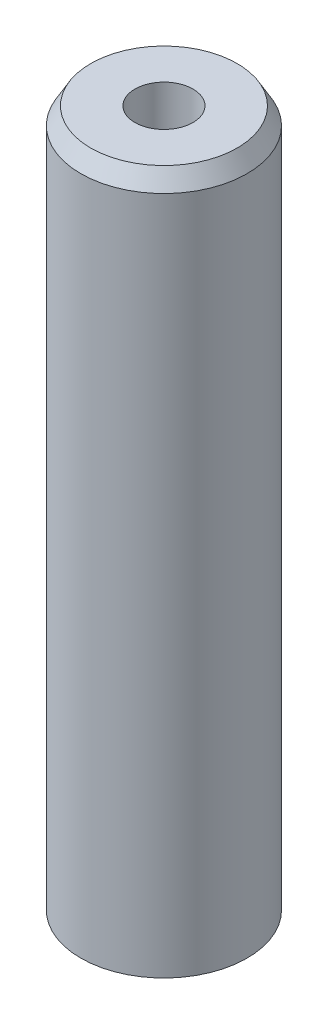
from build123d import *
from OCP.BRepFilletAPI import BRepFilletAPI_MakeChamfer

# Parameters (mm, degrees)
SKETCH1_R           = 25
BOSS_EXTRUDE1_DEPTH = 212.388772593
SKETCH2_R           = 8.729034927
CUT_EXTRUDE1_DEPTH  = 216.31138085
CHAMFER1_SIZE       = 5.175578628
CHAMFER1_SIZE2      = 2.988121714


with BuildPart() as part:
    # Sketch1 → Boss-Extrude1 (new body)
    with BuildSketch(Plane(origin=(0, 0, 0), x_dir=(1, 0, 0), z_dir=(0, 1, 0))):
        Circle(SKETCH1_R)
    extrude(amount=BOSS_EXTRUDE1_DEPTH)

    # Sketch2 → Cut-Extrude1 (cut, through all)
    with BuildSketch(Plane(origin=(0, 0, 0), x_dir=(1, 0, 0), z_dir=(0, 1, 0))):
        Circle(SKETCH2_R)
    extrude(amount=CUT_EXTRUDE1_DEPTH, mode=Mode.SUBTRACT)

    # Chamfer1: one chamfer whose edges measure the first distance from different faces: ONE call of the kernel's chamfer builder (chamfer() names one face for all edges)
    chamfer1_edges_1 = [part.edges().sort_by_distance(p)[0] for p in [
        (-25, 212.388772593, 0),
    ]]
    chamfer1_side_1 = [part.faces().sort_by_distance(p)[0] for p in [
        (-25, 106.194386296, 0),
    ]]
    chamfer1_edges_2 = [part.edges().sort_by_distance(p)[0] for p in [
        (-25, 0, 0),
    ]]
    chamfer1_side_2 = [part.faces().sort_by_distance(p)[0] for p in [
        (-24.292893219, 0, 0),
    ]]
    chamfer1 = BRepFilletAPI_MakeChamfer(part.part.solid().wrapped)
    for e in chamfer1_edges_1:
        chamfer1.Add(CHAMFER1_SIZE, CHAMFER1_SIZE2, e.wrapped, chamfer1_side_1[0].wrapped)  # the first distance lies on this face
    for e in chamfer1_edges_2:
        chamfer1.Add(CHAMFER1_SIZE, CHAMFER1_SIZE2, e.wrapped, chamfer1_side_2[0].wrapped)  # the first distance lies on this face
    add(Compound.cast(chamfer1.Shape()), mode=Mode.REPLACE)


solid = part.part
